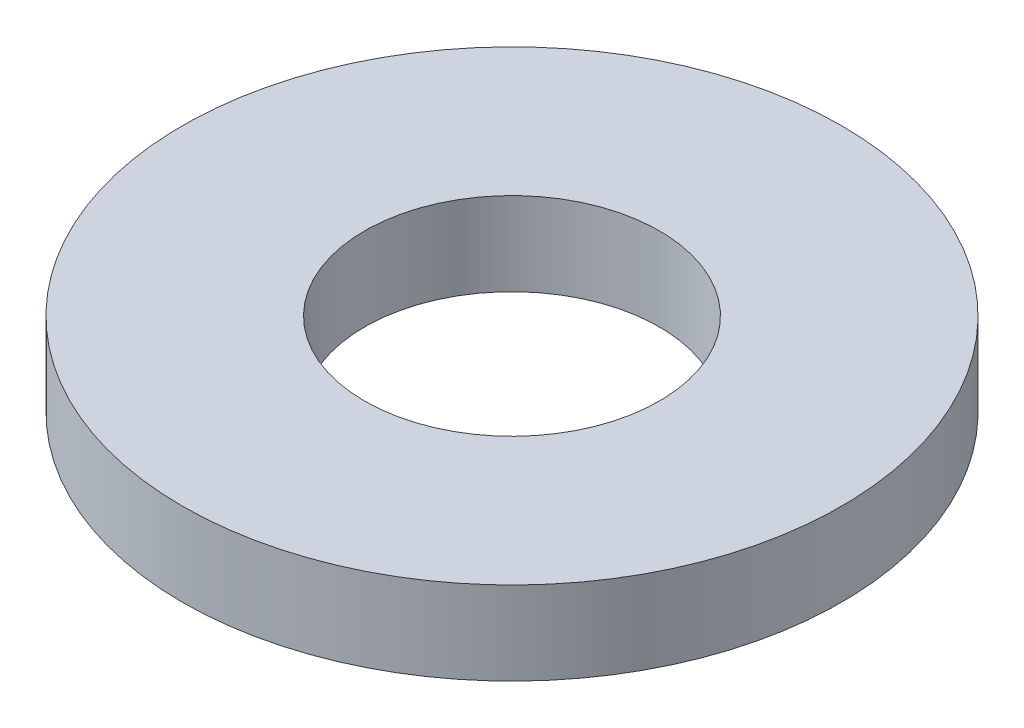
from build123d import *

# Parameters (mm, degrees)
SKETCH1_R           = 95
BOSS_EXTRUDE1_DEPTH = 24
SKETCH2_R           = 42.5
CUT_EXTRUDE1_DEPTH  = 137.477104307


with BuildPart() as part:
    # Sketch1 → Boss-Extrude1 (new body)
    with BuildSketch(Plane(origin=(0, 0, 0), x_dir=(1, 0, 0), z_dir=(0, 1, 0))):
        Circle(SKETCH1_R)
    extrude(amount=BOSS_EXTRUDE1_DEPTH)

    # Sketch2 → Cut-Extrude1 (cut, through all)
    with BuildSketch(Plane(origin=(0, 0, 0), x_dir=(1, 0, 0), z_dir=(0, 1, 0))):
        Circle(SKETCH2_R)
    extrude(amount=CUT_EXTRUDE1_DEPTH, mode=Mode.SUBTRACT)


solid = part.part
